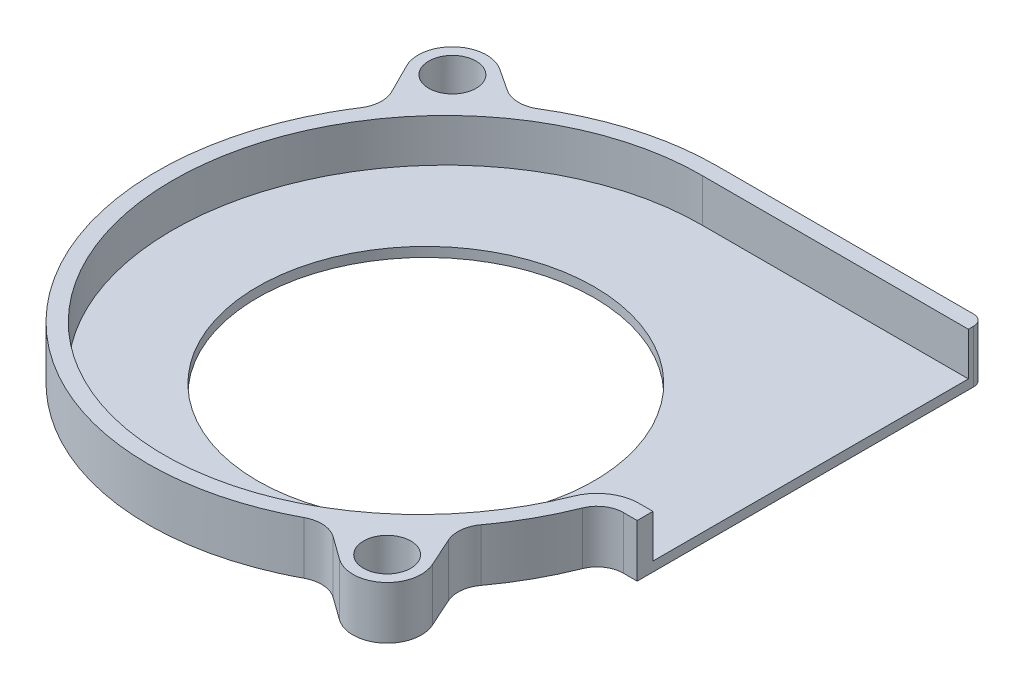
from build123d import *

# Parameters (mm, degrees)
SKETCH18_R          = 2.25
SKETCH18_R_2        = 16
BOSS_EXTRUDE2_DEPTH = 0.91
FILLET1_R           = 2.5
SKETCH22_R          = 2.25
BOSS_EXTRUDE3_DEPTH = 4.09


with BuildPart() as part:
    # Sketch18 → Boss-Extrude2 (new body)
    with BuildSketch(Plane(origin=(0, 0, 0), x_dir=(1, 0, 0), z_dir=(0, 1, 0))):
        with BuildLine():
            Line((-23.005700489, 21.173936517), (-21.582450949, 18.333239239))
            ThreePointArc((-21.582450949, 18.333239239), (-21.290226852, 16.922030245), (-21.738588357, 15.552403394))
            add(Edge.make_bspline(
                [(-21.738588357, 15.552403394), (-74.642199686, -65.790312539), (9.324862756, -20.895925284)],
                knots=[4.619035423, 4.619035423, 4.619035423, 7.234825226, 7.234825226, 7.234825226], degree=2, weights=[1, 0.259883374, 1]))
            ThreePointArc((9.324862756, -20.895925284), (10.831803609, -20.571378647), (12.282148638, -21.093586031))
            Line((12.282148638, -21.093586031), (14.423232763, -22.636631148))
            ThreePointArc((14.423232763, -22.636631148), (18.378398581, -22.5178413), (19.287328639, -18.666699414))
            Line((19.287328639, -18.666699414), (18.031066286, -15.874036932))
            ThreePointArc((18.031066286, -15.874036932), (17.800260945, -14.429576005), (18.329372436, -13.065838675))
            add(Edge.make_bspline(
                [(18.329372436, -13.065838675), (20.952057231, -9.501687367), (22.333293139, -5.3)],
                knots=[1.416240338, 1.416240338, 1.416240338, 1.752231262, 1.752231262, 1.752231262], degree=2, weights=[1, 0.985921919, 1]))
            Line((22.333293139, -5.3), (25.4, -5.3))
            Line((25.4, -5.3), (25.4, 26.7))
            ThreePointArc((25.4, 26.7), (25.107106781, 27.407106781), (24.4, 27.7))
            Line((24.4, 27.7), (-0.010581904, 27.7))
            add(Edge.make_bspline(
                [(-0.010581904, 27.7), (-7.028971285, 27.7), (-13.197915422, 23.907683644)],
                knots=[3.605852843, 3.605852843, 3.605852843, 4.154921422, 4.154921422, 4.154921422], degree=2, weights=[1, 0.962551555, 1]))
            ThreePointArc((-13.197915422, 23.907683644), (-14.708437667, 23.493357847), (-16.205141277, 23.955117118))
            Line((-16.205141277, 23.955117118), (-18.311498324, 25.343379249))
            ThreePointArc((-18.311498324, 25.343379249), (-22.258262373, 25.059651887), (-23.005700489, 21.173936517))
        make_face()
        with Locations((16.3234107, -20)):
            Circle(SKETCH18_R, mode=Mode.SUBTRACT)
        with Locations((-20.1, 22.629754043)):
            Circle(SKETCH18_R, mode=Mode.SUBTRACT)
        Circle(SKETCH18_R_2, mode=Mode.SUBTRACT)
    extrude(amount=BOSS_EXTRUDE2_DEPTH)

    # Fillet1
    fillet1_edges = [part.edges().sort_by_distance(p)[0] for p in [
        (22.333293139, 0.455, 5.3),
    ]]
    fillet(fillet1_edges, radius=FILLET1_R)

    # Sketch22 → Boss-Extrude3 (add)
    with BuildSketch(Plane(origin=(0, 0.91, 0), x_dir=(-1, 0, 0), z_dir=(0, -1, 0))):
        with BuildLine():
            Line((0.010581904, 27.7), (-24.4, 27.7))
            ThreePointArc((-24.4, 27.7), (-25.107106781, 27.407106781), (-25.4, 26.7))
            Line((-25.4, 26.7), (-25.4, 26.2))
            Line((-25.4, 26.2), (-0.134529672, 26.2))
            add(Edge.make_bspline(
                [(-20.367528733, -6.322552603), (-2.799285505, -50.52288462), (21.15759874, -12.014553468), (45.114482985, 26.493777684), (-0.134529672, 26.2)],
                knots=[1.453228322, 1.453228322, 1.453228322, 3.639957949, 3.639957949, 5.826687576, 5.826687576, 5.826687576], degree=2, weights=[1, 0.45949942, 1, 0.45949942, 1]))
            ThreePointArc((-20.367528733, -6.322552603), (-21.83854018, -4.49018206), (-24.084671344, -3.8))
            Line((-24.084671344, -3.8), (-25.4, -3.8))
            Line((-25.4, -3.8), (-25.4, -5.3))
            Line((-25.4, -5.3), (-24.084632068, -5.3))
            ThreePointArc((-24.084632068, -5.3), (-22.680778329, -5.731378556), (-21.761398508, -6.876644257))
            add(Edge.make_bspline(
                [(-21.761398508, -6.876644257), (-20.443306322, -10.193064851), (-18.329372436, -13.065838675)],
                knots=[4.595237109, 4.595237109, 4.595237109, 4.866944969, 4.866944969, 4.866944969], degree=2, weights=[1, 0.990786039, 1]))
            ThreePointArc((-18.329372436, -13.065838675), (-17.800260945, -14.429576005), (-18.031066286, -15.874036932))
            Line((-18.031066286, -15.874036932), (-19.287328639, -18.666699414))
            ThreePointArc((-19.287328639, -18.666699414), (-18.378398581, -22.5178413), (-14.423232763, -22.636631148))
            Line((-14.423232763, -22.636631148), (-12.282148638, -21.093586031))
            ThreePointArc((-12.282148638, -21.093586031), (-10.831803609, -20.571378647), (-9.324862756, -20.895925284))
            add(Edge.make_bspline(
                [(-9.324862756, -20.895925284), (74.642199686, -65.790312539), (21.738588357, 15.552403394)],
                knots=[5.331545389, 5.331545389, 5.331545389, 7.947335192, 7.947335192, 7.947335192], degree=2, weights=[1, 0.259883374, 1]))
            ThreePointArc((21.738588357, 15.552403394), (21.290226852, 16.922030245), (21.582450949, 18.333239239))
            Line((21.582450949, 18.333239239), (23.005700489, 21.173936517))
            ThreePointArc((23.005700489, 21.173936517), (22.258262373, 25.059651887), (18.311498324, 25.343379249))
            Line((18.311498324, 25.343379249), (16.205141277, 23.955117118))
            ThreePointArc((16.205141277, 23.955117118), (14.708437667, 23.493357847), (13.197915422, 23.907683644))
            add(Edge.make_bspline(
                [(13.197915422, 23.907683644), (7.028971285, 27.7), (0.010581904, 27.7)],
                knots=[2.128263885, 2.128263885, 2.128263885, 2.677332464, 2.677332464, 2.677332464], degree=2, weights=[1, 0.962551555, 1]))
        make_face()
        with Locations((20.1, 22.629754043)):
            Circle(SKETCH22_R, mode=Mode.SUBTRACT)
        with Locations((-16.3234107, -20)):
            Circle(SKETCH22_R, mode=Mode.SUBTRACT)
    extrude(amount=-BOSS_EXTRUDE3_DEPTH)


solid = part.part
